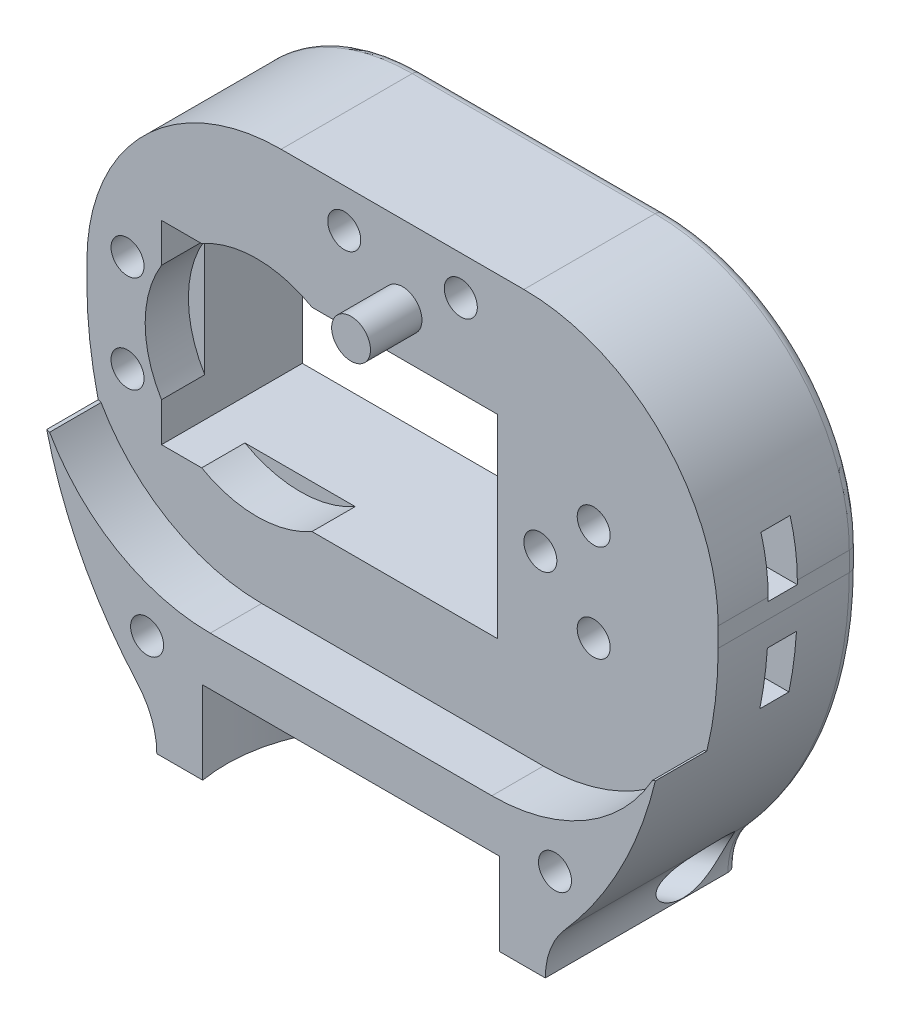
from build123d import *

# Parameters (mm, degrees)
CROQUIS1_R              = 1.7
CROQUIS1_W              = 34.6
CROQUIS1_H              = 20
SALIENTE_EXTRUIR1_DEPTH = 19.8
CROQUIS2_R              = 2
CORTAR_EXTRUIR1_DEPTH   = 5.3
REDONDEO1_R             = 1
CROQUIS3_W              = 6.4
CROQUIS3_H              = 20
CORTAR_EXTRUIR2_DEPTH   = 7.5
CROQUIS4_R              = 1.7
CORTAR_EXTRUIR3_DEPTH   = 8
CORTAR_EXTRUIR4_DEPTH   = 11.7
CORTAR_EXTRUIR5_DEPTH   = 3
CROQUIS7_R              = 1.7
CORTAR_EXTRUIR6_DEPTH   = 32
CORTAR_EXTRUIR7_DEPTH   = 11.7
CROQUIS9_R              = 15.5
CORTAR_EXTRUIR8_DEPTH   = 8.5
CORTAR_EXTRUIR9_START   = -10.5
CROQUIS10_R             = 1.7
CORTAR_EXTRUIR9_DEPTH   = 25.5
CROQUIS11_R             = 2.95
CORTAR_EXTRUIR10_DEPTH  = 10.5
CROQUIS12_R             = 11.5
CORTAR_EXTRUIR11_DEPTH  = 4.45
CORTAR_EXTRUIR12_DEPTH  = 6


with BuildPart() as part:
    # Croquis1 → Saliente-Extruir1 (new body)
    with BuildSketch(Plane.XY):
        with BuildLine():
            Line((-20, 0), (20, 0))
            ThreePointArc((20, 0), (20.516685226, 2.828427125), (22, 5.291502622))
            ThreePointArc((22, 5.291502622), (29.774696313, 18.189029951), (32.5, 33))
            Line((32.5, 33), (32.5, 35))
            ThreePointArc((32.5, 35), (26.642135624, 49.142135624), (12.5, 55))
            Line((12.5, 55), (-12.5, 55))
            ThreePointArc((-12.5, 55), (-26.642135624, 49.142135624), (-32.5, 35))
            Line((-32.5, 35), (-32.5, 33))
            ThreePointArc((-32.5, 33), (-29.774696313, 18.189029951), (-22, 5.291502622))
            ThreePointArc((-22, 5.291502622), (-20.516685226, 2.828427125), (-20, 0))
        make_face()
        with Locations(Location((19.685, 37.5, 0), (0, 0, 180))):
            Circle(CROQUIS1_R, mode=Mode.SUBTRACT)
        with Locations(Location((19.685, 27.5, 0), (0, 0, 180))):
            Circle(CROQUIS1_R, mode=Mode.SUBTRACT)
        with Locations(Location((-28.315, 37.5, 0), (0, 0, 180))):
            Circle(CROQUIS1_R, mode=Mode.SUBTRACT)
        with Locations(Location((-28.315, 27.5, 0), (0, 0, 180))):
            Circle(CROQUIS1_R, mode=Mode.SUBTRACT)
        with Locations(Location((-6, 51, 0), (0, 0, 180))):
            Circle(CROQUIS1_R, mode=Mode.SUBTRACT)
        with Locations(Location((6, 51, 0), (0, 0, 180))):
            Circle(CROQUIS1_R, mode=Mode.SUBTRACT)
        with Locations((-7.515, 32.5)):
            Rectangle(CROQUIS1_W, CROQUIS1_H, mode=Mode.SUBTRACT)
    extrude(amount=SALIENTE_EXTRUIR1_DEPTH)

    # Croquis2 → Cortar-Extruir1 (cut)
    with BuildSketch(Plane.XY.offset(19.8)):
        with BuildLine():
            Line((-14.5, 13.5), (14.5, 13.5))
            ThreePointArc((14.5, 13.5), (28.068203525, 19.199479216), (33.496228734, 32.878541777))
            ThreePointArc((33.496228734, 32.878541777), (0, 120), (-33.496228734, 32.878541777))
            ThreePointArc((-33.496228734, 32.878541777), (-28.068203525, 19.199479216), (-14.5, 13.5))
        make_face()
        with Locations((0, 47)):
            Circle(CROQUIS2_R, mode=Mode.SUBTRACT)
    extrude(amount=-CORTAR_EXTRUIR1_DEPTH, mode=Mode.SUBTRACT)

    # Redondeo1
    redondeo1_edges = [part.edges().sort_by_distance(p)[0] for p in [
        (-32.5, 34, 0),
        (-26.642135624, 49.142135624, 0),
        (0, 55, 0),
        (26.642135624, 49.142135624, 0),
        (32.5, 34, 0),
        (29.774696313, 18.189029951, 0),
        (20.516685226, 2.828427125, 0),
        (-20.516685226, 2.828427125, 0),
        (-29.774696313, 18.189029951, 0),
    ]]
    fillet(redondeo1_edges, radius=REDONDEO1_R)

    # Chaflán1
    # the kernel refuses this chamfer: 1, 0.825041692 mm, written as the material it takes off along each edge
    with BuildSketch(Plane(origin=(31.521229792, 24.05738569, 22.443985688), x_dir=(-0.4684252957898937, -0.883503108236836, 0), z_dir=(0, 0, -1))) as chafl_n1_piece_1:
        with BuildLine():
            Line((1.028197231, 0), (0.801835652, -0.214430341))
            ThreePointArc((0.801835652, -0.214430341), (0.390274265, -0.106489922), (0, 0))
            ThreePointArc((0, 0), (0.528634069, -0.006950908), (1.028197231, 0))
        make_face()
    extrude(amount=7.943985688, mode=Mode.SUBTRACT)
    with BuildSketch(Plane(origin=(-31.521229792, 24.05738569, 22.443985688), x_dir=(0.22427400175018, -0.9745261269657989, 0), z_dir=(0, 0, -1))) as chafl_n1_piece_2:
        with BuildLine():
            Line((0.830012521, 0), (0.993292483, -0.265630551))
            ThreePointArc((0.993292483, -0.265630551), (0.512483991, -0.129855509), (0, 0))
            ThreePointArc((0, 0), (0.404536656, 0.002049093), (0.830012521, 0))
        make_face()
    extrude(amount=7.943985688, mode=Mode.SUBTRACT)

    # Croquis3 → Cortar-Extruir2 (cut)
    with BuildSketch(Plane(origin=(0, 0, 0), x_dir=(-1, 0, 0), z_dir=(0, 0, -1))):
        with Locations((-12.985, 32.5)):
            Rectangle(CROQUIS3_W, CROQUIS3_H)
    extrude(amount=-CORTAR_EXTRUIR2_DEPTH, mode=Mode.SUBTRACT)

    # Croquis4 → Cortar-Extruir3 (cut)
    with BuildSketch(Plane.XY.offset(14.5)):
        with Locations((14.19, 32.5)):
            Circle(CROQUIS4_R)
    extrude(amount=-CORTAR_EXTRUIR3_DEPTH, mode=Mode.SUBTRACT)

    # Croquis5 → Cortar-Extruir4 (cut)
    with BuildSketch(Plane(origin=(0, 0, 0), x_dir=(-1, 0, 0), z_dir=(0, 0, -1))):
        Polygon((-17.091185103, 34.175), (-17.091185103, 30.825), (-14.19, 29.15), (-11.288814897, 30.825), (-11.288814897, 34.175), (-14.19, 35.85), align=None)
    extrude(amount=-CORTAR_EXTRUIR4_DEPTH, mode=Mode.SUBTRACT)

    # Croquis6 → Cortar-Extruir5 (cut)
    with BuildSketch(Plane.XY.offset(6.35)):
        Polygon((22.36, 40.401185103), (38.01, 40.401185103), (38.01, 34.598814897), (22.36, 34.598814897), (18.01, 34.598814897), (16.335, 37.5), (18.01, 40.401185103), align=None)
        Polygon((-24.965, 37.5), (-26.64, 40.401185103), (-30.79, 40.401185103), (-46.64, 40.401185103), (-46.64, 34.598814897), (-30.79, 34.598814897), (-26.64, 34.598814897), align=None)
        Polygon((-24.965, 27.5), (-26.64, 30.401185103), (-30.79, 30.401185103), (-46.64, 30.401185103), (-46.64, 24.598814897), (-30.79, 24.598814897), (-26.64, 24.598814897), align=None)
        Polygon((22.36, 30.401185103), (18.01, 30.401185103), (16.335, 27.5), (18.01, 24.598814897), (22.36, 24.598814897), (38.01, 24.598814897), (38.01, 30.401185103), align=None)
    extrude(amount=CORTAR_EXTRUIR5_DEPTH, mode=Mode.SUBTRACT)

    # Croquis7 → Cortar-Extruir6 (cut)
    with BuildSketch(Plane.XY.offset(19.8)):
        with Locations((-21, 10)):
            Circle(CROQUIS7_R)
        with Locations((21, 10)):
            Circle(CROQUIS7_R)
    extrude(amount=-CORTAR_EXTRUIR6_DEPTH, mode=Mode.SUBTRACT)

    # Croquis8 → Cortar-Extruir7 (cut)
    with BuildSketch(Plane(origin=(0, 0, 0), x_dir=(-1, 0, 0), z_dir=(0, 0, -1))):
        Polygon((-18.098814897, 11.675), (-21, 13.35), (-23.901185103, 11.675), (-23.901185103, 8.325), (-21, 6.65), (-18.098814897, 8.325), align=None)
        Polygon((18.098814897, 11.675), (18.098814897, 8.325), (21, 6.65), (23.901185103, 8.325), (23.901185103, 11.675), (21, 13.35), align=None)
    extrude(amount=-CORTAR_EXTRUIR7_DEPTH, mode=Mode.SUBTRACT)

    # Croquis9 → Cortar-Extruir8 (cut)
    with BuildSketch(Plane.XZ):
        with Locations((0, 17.15)):
            Circle(CROQUIS9_R)
    extrude(amount=-CORTAR_EXTRUIR8_DEPTH, mode=Mode.SUBTRACT)

    # Croquis10 → Cortar-Extruir9 (cut)
    with BuildSketch(Plane(origin=(-7.426167837, 0, -4.2875), x_dir=(0, 1, 0), z_dir=(0.8660254037844398, 0, 0.499999999999998)).offset(CORTAR_EXTRUIR9_START)):
        with Locations(Location((3, 14.850778558, 0), (0, 0, 90))):
            Circle(CROQUIS10_R)
    cortar_extruir9 = extrude(amount=CORTAR_EXTRUIR9_DEPTH, mode=Mode.SUBTRACT)

    # Croquis11 → Cortar-Extruir10 (cut)
    with BuildSketch(Plane(origin=(-9.825058206, 0, -5.6725), x_dir=(0, 1, 0), z_dir=(0.8660254037844398, 0, 0.499999999999998))):
        with Locations(Location((3, 14.850778558, 0), (0, 0, 270))):
            Circle(CROQUIS11_R)
    cortar_extruir10 = extrude(amount=-CORTAR_EXTRUIR10_DEPTH, mode=Mode.SUBTRACT)

    # Simetría1: Cortar-Extruir9, Cortar-Extruir10 across plane
    add(cortar_extruir9.mirror(Plane(origin=(0, 0, 0), x_dir=(0, 0, 1), z_dir=(1, 0, 0))), mode=Mode.SUBTRACT)
    add(cortar_extruir10.mirror(Plane(origin=(0, 0, 0), x_dir=(0, 0, 1), z_dir=(1, 0, 0))), mode=Mode.SUBTRACT)

    # Croquis12 → Cortar-Extruir11 (cut)
    with BuildSketch(Plane.XY.offset(14.5)):
        with Locations((-15, 32.5)):
            Circle(CROQUIS12_R)
    extrude(amount=-CORTAR_EXTRUIR11_DEPTH, mode=Mode.SUBTRACT)

    # Croquis13 → Cortar-Extruir12 (cut)
    with BuildSketch(Plane(origin=(0, 0, 0), x_dir=(-1, 0, 0), z_dir=(0, 0, -1))):
        Polygon((-9.35, 51), (-7.675, 48.098814897), (-4.325, 48.098814897), (-2.65, 51), (-4.325, 53.901185103), (-7.675, 53.901185103), align=None)
        Polygon((2.65, 51), (4.325, 48.098814897), (7.675, 48.098814897), (9.35, 51), (7.675, 53.901185103), (4.325, 53.901185103), align=None)
    extrude(amount=-CORTAR_EXTRUIR12_DEPTH, mode=Mode.SUBTRACT)


solid = part.part
